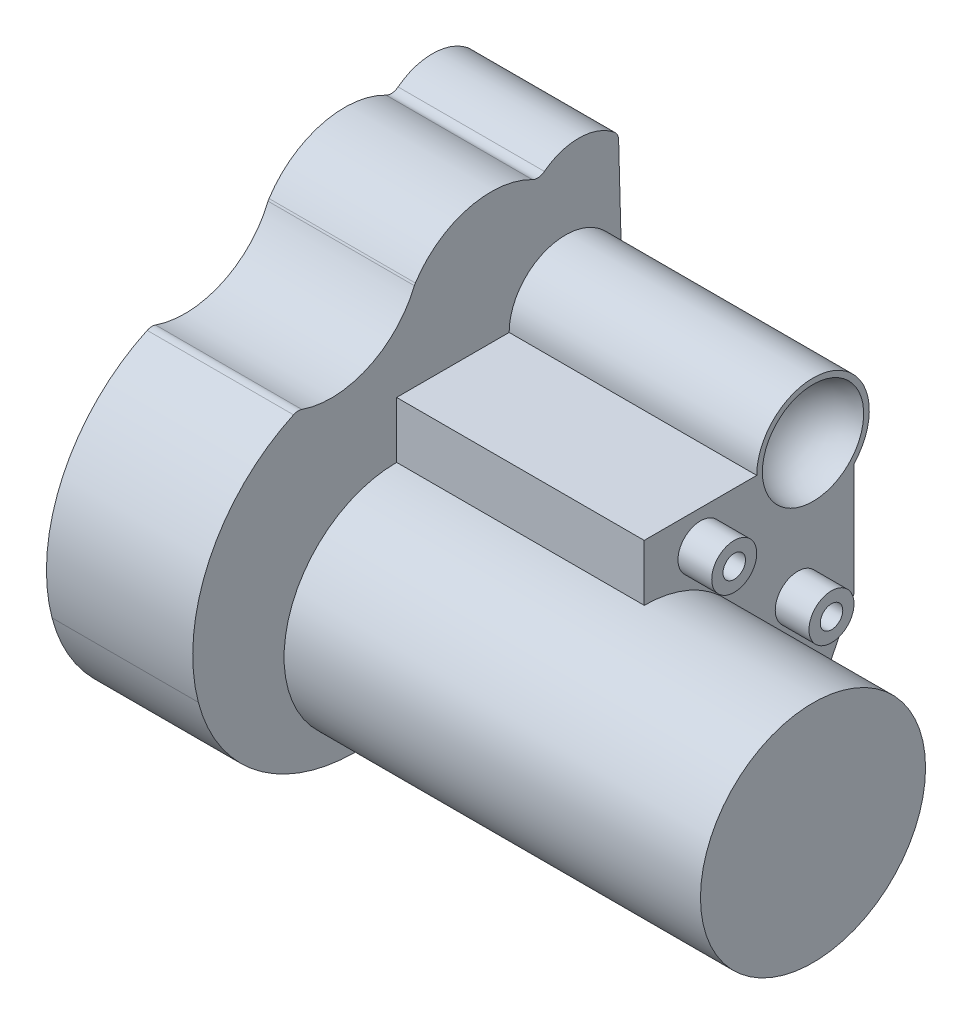
from build123d import *

# Parameters (mm, degrees)
SKETCH1_R           = 10
BOSS_EXTRUDE1_DEPTH = 50
BOSS_EXTRUDE3_DEPTH = 35
SKETCH8_R           = 2
SKETCH8_R_2         = 1
BOSS_EXTRUDE4_DEPTH = 3
BOSS_EXTRUDE6_DEPTH = 13
FILLET1_R           = 1
FILLET2_R           = 1


with BuildPart() as part:
    # Sketch1 → Boss-Extrude1 (new body)
    with BuildSketch(Plane(origin=(0, 0, 0), x_dir=(0, 0, -1), z_dir=(1, 0, 0))):
        Circle(SKETCH1_R)
    extrude(amount=-BOSS_EXTRUDE1_DEPTH)

    # Sketch3 → Boss-Extrude3 (add)
    with BuildSketch(Plane(origin=(-50, 0, 0), x_dir=(0, 0, -1), z_dir=(1, 0, 0))):
        with BuildLine():
            Line((0, 10), (0, 15))
            Line((0, 15), (10, 15))
            ThreePointArc((10, 15), (16.842071907, 19.648308412), (18.642708436, 11.574992664))
            Line((18.642708436, 11.574992664), (18.642708436, 1.574992664))
            Line((18.642708436, 1.574992664), (16.642708436, -2.425007336))
            Line((16.642708436, -2.425007336), (16.642708436, -9.997750449))
            ThreePointArc((16.642708436, -9.997750449), (13.321760405, -11.198307119), (10, -10))
            Line((10, -10), (0, -10))
            Line((0, -10), (0, 10))
        make_face()
    extrude(amount=BOSS_EXTRUDE3_DEPTH)

    # Sketch6 → Cut-Revolve1 (revolve, cut)
    with BuildSketch(Plane(origin=(-15, 0, 0), x_dir=(0, 0, -1), z_dir=(1, 0, 0))):
        with BuildLine():
            Line((13.321760405, -1.448307119), (13.321760405, -10.948307119))
            ThreePointArc((13.321760405, -10.948307119), (18.071760405, -6.198307119), (13.321760405, -1.448307119))
        make_face()
    revolve(axis=Axis((-15, -1.448307119, -13.321760405), (0, -1, 0)), mode=Mode.SUBTRACT)

    # Sketch7 → Cut-Revolve2 (revolve, cut)
    with BuildSketch(Plane(origin=(-15, 0, 0), x_dir=(0, 0, -1), z_dir=(1, 0, 0))):
        with BuildLine():
            Line((15, 10.5), (15, 19.5))
            ThreePointArc((15, 19.5), (19.5, 15), (15, 10.5))
        make_face()
    revolve(axis=Axis((-15, 10.5, -15), (0, 1, 0)), mode=Mode.SUBTRACT)

    # Sketch8 → Boss-Extrude4 (add)
    # profile 1 of 2: a face of its own
    with BuildSketch(Plane(origin=(-15, 0, 0), x_dir=(0, 0, -1), z_dir=(1, 0, 0))):
        with Locations((13.642708436, 3.801692881)):
            Circle(SKETCH8_R)
        with Locations((13.642708436, 3.801692881)):
            Circle(SKETCH8_R_2, mode=Mode.SUBTRACT)
    # profile 2 of 2: a face of its own
    with BuildSketch(Plane(origin=(-15, 0, 0), x_dir=(0, 0, -1), z_dir=(1, 0, 0))):
        with Locations((5, 12)):
            Circle(SKETCH8_R)
        with Locations((5, 12)):
            Circle(SKETCH8_R_2, mode=Mode.SUBTRACT)
    extrude(amount=BOSS_EXTRUDE4_DEPTH)

    # Sketch10 → Boss-Extrude6 (add)
    with BuildSketch(Plane.ZY.offset(50)):
        with BuildLine():
            Line((-19.714603594, 25.400073987), (-19.992475161, 15.274211174))
            ThreePointArc((-19.992475161, 15.274211174), (-14.862842799, 19.998118436), (-10, 15))
            Line((-10, 15), (0, 15))
            Line((0, 15), (0, 10))
            ThreePointArc((0, 10), (10, 0), (0, -10))
            ThreePointArc((0, -10), (10.951955319, -8.476456548), (17.618849286, 0.345053233))
            ThreePointArc((17.618849286, 0.345053233), (16.545732573, 11.017476726), (8.77988791, 18.416386062))
            ThreePointArc((8.77988791, 18.416386062), (2.657537615, 18.500996178), (-1.611789409, 22.889979975))
            ThreePointArc((-1.611789409, 22.889979975), (-6.607805104, 26.429776463), (-12.643535782, 25.400073987))
            ThreePointArc((-12.643535782, 25.400073987), (-16.179069688, 26.864540081), (-19.714603594, 25.400073987))
        make_face()
    extrude(amount=-BOSS_EXTRUDE6_DEPTH)

    # Fillet1
    fillet1_edges = [part.edges().sort_by_distance(p)[0] for p in [
        (-43.5, 18.416386062, 8.77988791),
        (-43.5, 22.889979975, -1.611789409),
        (-43.5, 25.400073987, -12.643535782),
    ]]
    fillet(fillet1_edges, radius=FILLET1_R)

    # Fillet2
    fillet2_edges = [part.edges().sort_by_distance(p)[0] for p in [
        (-43.5, 25.400073987, -19.714603594),
    ]]
    fillet(fillet2_edges, radius=FILLET2_R)

    # Sketch11 → Cut-Revolve3 (revolve, cut)
    with BuildSketch(Plane(origin=(0, 0.559709606, -20.396267082), x_dir=(-1, 0, 0), z_dir=(0, 0.02743144017102401, -0.999623687239425))):
        with BuildLine():
            Line((50, 24.072659381), (50, 15.072659381))
            ThreePointArc((50, 15.072659381), (45.5, 19.572659381), (50, 24.072659381))
        make_face()
    revolve(axis=Axis((-50, 24.623310138, -19.735919367), (0, -0.9996236872394249, -0.027431440171024075)), mode=Mode.SUBTRACT)


solid = part.part
